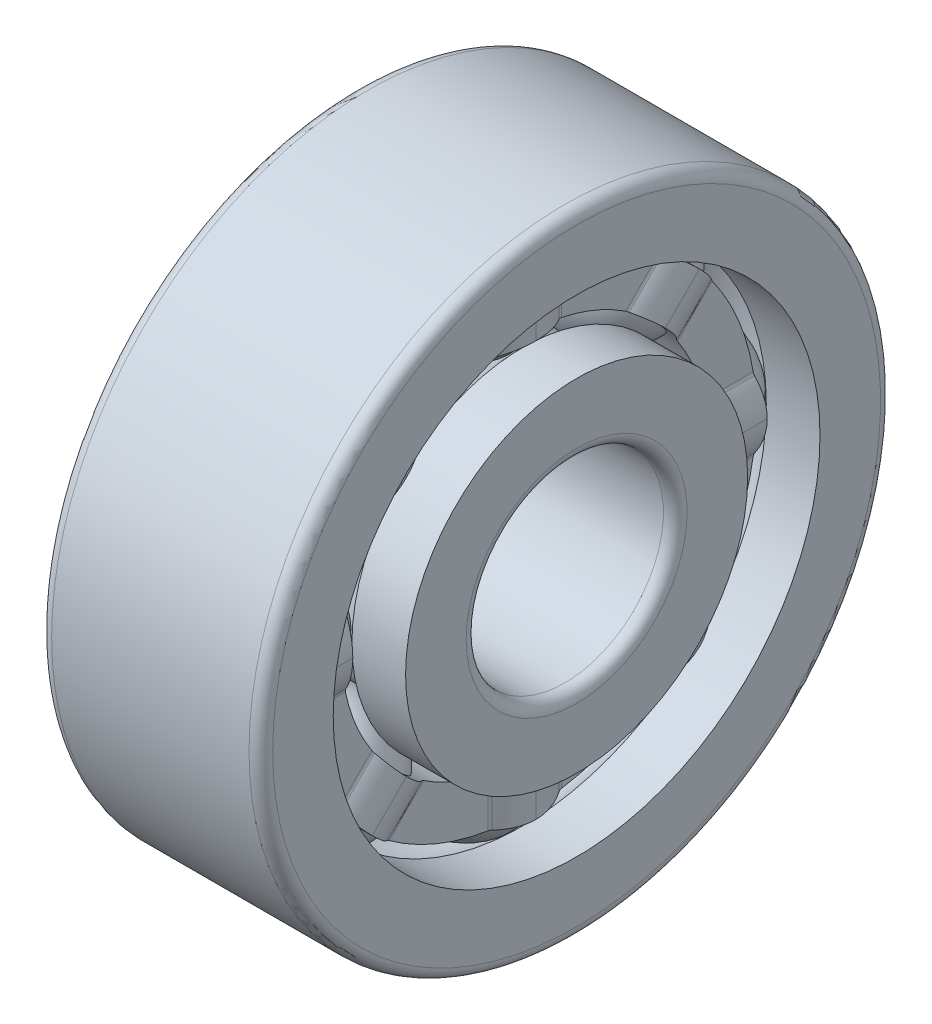
from build123d import *

# Parameters (mm, degrees)
SKETCH10_W                = 1.768078638
SKETCH10_H                = 0.611111112
PATTERN_BALL_COUNT        = 8
COSMETIC_FILLET_OUTER_1_R = 0.15
COSMETIC_FILLET_OUTER_2_R = 0.15
COSMETIC_FILLET_INNER_1_R = 0.15
COSMETIC_FILLET_INNER_2_R = 0.15


with BuildPart() as part:
    # Sketch7 → Body-Ball (revolve)
    with BuildSketch(Plane.XY):
        with BuildLine():
            Line((-0.825, 2.625), (0.825, 2.625))
            ThreePointArc((0.825, 2.625), (0, 1.8), (-0.825, 2.625))
        make_face()
    body_ball = revolve(axis=Axis((-0.825, 2.625, 0), (1, 0, 0)))

    # Sketch10 → Body-Ball-Cage (revolve)
    with BuildSketch(Plane.XY, mode=Mode.PRIVATE) as body_ball_cage_sk:
        with Locations((0, 2.625)):
            Rectangle(SKETCH10_W, SKETCH10_H)
    revolve(body_ball_cage_sk.sketch.rotate(Axis((-1.4, 0, 0), (1, 0, 0)), 90), axis=Axis((-1.4, 0, 0), (1, 0, 0)))

    # Sketch16 for Cut-Ball-Cag → Cut-Ball-Cage-1 section 0
    with BuildSketch(Plane(origin=(0, 1.486002892, 0.615522552), x_dir=(-1, 0, 0), z_dir=(-3.4914833611093817e-15, 0.9238795325112837, 0.38268343236509716))):
        with BuildLine():
            Line((0.743092648, -0.163814704), (0.743092648, 0.163814704))
            # circular arc as an exact rational Bezier (weights 1, cos(half-angle), 1)
            Bezier((0.743092648, 0.163814704), (0.743092648, 0.186792532), (0.755044207, 0.206417537), weights=[1, 0.962830312, 1])
            Bezier((0.755044207, 0.206417537), (0.884039319, 0.418233392), (0.884039319, 0.666236809), weights=[1, 0.962830312, 1])
            Line((0.884039319, 0.666236809), (0.884039319, -0.666236809))
            Bezier((0.884039319, -0.666236809), (0.884039319, -0.418233392), (0.755044207, -0.206417537), weights=[1, 0.962830312, 1])
            Bezier((0.755044207, -0.206417537), (0.743092648, -0.186792532), (0.743092648, -0.163814704), weights=[1, 0.962830312, 1])
        make_face()
    # Sketch17 for Cut-Ball-Cag → Cut-Ball-Cage-1 section 1
    with BuildSketch(Plane(origin=(0, 2.995152408, 1.240632749), x_dir=(1, 0, 0), z_dir=(-3.4914833611093844e-15, -0.9238795325112863, -0.3826834323650908))):
        with BuildLine():
            Line((-0.743092648, -0.840429106), (-0.743092648, 0.840429106))
            Bezier((-0.743092648, 0.840429106), (-0.743092648, 0.863406934), (-0.755044207, 0.883031939), weights=[1, 0.962830312, 1])
            Bezier((-0.755044207, 0.883031939), (-0.884039319, 1.094847793), (-0.884039319, 1.342851211), weights=[1, 0.962830312, 1])
            Line((-0.884039319, 1.342851211), (-0.884039319, -1.342851211))
            Bezier((-0.884039319, -1.342851211), (-0.884039319, -1.094847793), (-0.755044207, -0.883031939), weights=[1, 0.962830312, 1])
            Bezier((-0.755044207, -0.883031939), (-0.743092648, -0.863406934), (-0.743092648, -0.840429106), weights=[1, 0.962830312, 1])
        make_face()
    cut_ball_cage_1 = loft(mode=Mode.SUBTRACT)

    # Sketch15 for Cut-Ball-Cag → Cut-Ball-Cage-2 section 0
    with BuildSketch(Plane(origin=(0, 2.995152408, 1.240632749), x_dir=(1, 0, 0), z_dir=(-3.4914833611093844e-15, -0.9238795325112863, -0.3826834323650908))):
        with BuildLine():
            Line((0.743092648, -0.840429106), (0.743092648, 0.840429106))
            Bezier((0.743092648, 0.840429106), (0.743092648, 0.863406934), (0.755044207, 0.883031939), weights=[1, 0.962830312, 1])
            Bezier((0.755044207, 0.883031939), (0.884039319, 1.094847793), (0.884039319, 1.342851211), weights=[1, 0.962830312, 1])
            Line((0.884039319, 1.342851211), (0.884039319, -1.342851211))
            Bezier((0.884039319, -1.342851211), (0.884039319, -1.094847793), (0.755044207, -0.883031939), weights=[1, 0.962830312, 1])
            Bezier((0.755044207, -0.883031939), (0.743092648, -0.863406934), (0.743092648, -0.840429106), weights=[1, 0.962830312, 1])
        make_face()
    # Sketch14 for Cut-Ball-Cag → Cut-Ball-Cage-2 section 1
    with BuildSketch(Plane(origin=(0, 1.486002892, 0.615522552), x_dir=(-1, 0, 0), z_dir=(-3.4914833611093817e-15, 0.9238795325112837, 0.38268343236509716))):
        with BuildLine():
            Line((-0.743092648, -0.163814704), (-0.743092648, 0.163814704))
            Bezier((-0.743092648, 0.163814704), (-0.743092648, 0.186792532), (-0.755044207, 0.206417537), weights=[1, 0.962830312, 1])
            Bezier((-0.755044207, 0.206417537), (-0.884039319, 0.418233392), (-0.884039319, 0.666236809), weights=[1, 0.962830312, 1])
            Line((-0.884039319, 0.666236809), (-0.884039319, -0.666236809))
            Bezier((-0.884039319, -0.666236809), (-0.884039319, -0.418233392), (-0.755044207, -0.206417537), weights=[1, 0.962830312, 1])
            Bezier((-0.755044207, -0.206417537), (-0.743092648, -0.186792532), (-0.743092648, -0.163814704), weights=[1, 0.962830312, 1])
        make_face()
    cut_ball_cage_2 = loft(mode=Mode.SUBTRACT)

    # Pattern-Ball: Body-Ball, Cut-Ball-Cage-1, Cut-Ball-Cage-2 ×8 about axis
    pattern_ball_axis = Axis((-2.75, 0, 0), (1, 0, 0))
    add([body_ball.rotate(pattern_ball_axis, i * 360 / PATTERN_BALL_COUNT) for i in range(1, PATTERN_BALL_COUNT)])
    add([cut_ball_cage_1.rotate(pattern_ball_axis, i * 360 / PATTERN_BALL_COUNT) for i in range(1, PATTERN_BALL_COUNT)], mode=Mode.SUBTRACT)
    add([cut_ball_cage_2.rotate(pattern_ball_axis, i * 360 / PATTERN_BALL_COUNT) for i in range(1, PATTERN_BALL_COUNT)], mode=Mode.SUBTRACT)

    # Sketch2 → Body-Inner (revolve)
    with BuildSketch(Plane.XY, mode=Mode.PRIVATE) as body_inner_sk:
        with BuildLine():
            Line((-1.4, 2.166666667), (-1.4, 1.25))
            Line((-1.4, 1.25), (1.4, 1.25))
            Line((1.4, 1.25), (1.4, 2.166666667))
            Line((1.4, 2.166666667), (0.719640589, 2.166666667))
            ThreePointArc((0.719640589, 2.166666667), (0, 1.833670068), (-0.719640589, 2.166666667))
            Line((-0.719640589, 2.166666667), (-1.4, 2.166666667))
        make_face()
    revolve(body_inner_sk.sketch.rotate(Axis((-1.4, 0, 0), (1, 0, 0)), 90), axis=Axis((-1.4, 0, 0), (1, 0, 0)))

    # Sketch8 → Body-Outer (revolve)
    with BuildSketch(Plane.XY, mode=Mode.PRIVATE) as body_outer_sk:
        with BuildLine():
            Line((-1.4, 4), (-1.4, 3.083333333))
            Line((-1.4, 3.083333333), (-0.719640589, 3.083333333))
            ThreePointArc((-0.719640589, 3.083333333), (0, 3.416329932), (0.719640589, 3.083333333))
            Line((0.719640589, 3.083333333), (1.4, 3.083333333))
            Line((1.4, 3.083333333), (1.4, 4))
            Line((1.4, 4), (-1.4, 4))
        make_face()
    revolve(body_outer_sk.sketch.rotate(Axis((-1.4, 0, 0), (1, 0, 0)), 90), axis=Axis((-1.4, 0, 0), (1, 0, 0)))

    # Cosmetic-Fillet-Outer-1
    cosmetic_fillet_outer_1_edges = [part.edges().sort_by_distance(p)[0] for p in [
        (-1.4, 0, -4),
    ]]
    fillet(cosmetic_fillet_outer_1_edges, radius=COSMETIC_FILLET_OUTER_1_R)

    # Cosmetic-Fillet-Outer-2
    cosmetic_fillet_outer_2_edges = [part.edges().sort_by_distance(p)[0] for p in [
        (1.4, 0, -4),
    ]]
    fillet(cosmetic_fillet_outer_2_edges, radius=COSMETIC_FILLET_OUTER_2_R)

    # Cosmetic-Fillet-Inner-1
    cosmetic_fillet_inner_1_edges = [part.edges().sort_by_distance(p)[0] for p in [
        (-1.4, 0, -1.25),
    ]]
    fillet(cosmetic_fillet_inner_1_edges, radius=COSMETIC_FILLET_INNER_1_R)

    # Cosmetic-Fillet-Inner-2
    cosmetic_fillet_inner_2_edges = [part.edges().sort_by_distance(p)[0] for p in [
        (1.4, 0, -1.25),
    ]]
    fillet(cosmetic_fillet_inner_2_edges, radius=COSMETIC_FILLET_INNER_2_R)


solid = part.part
